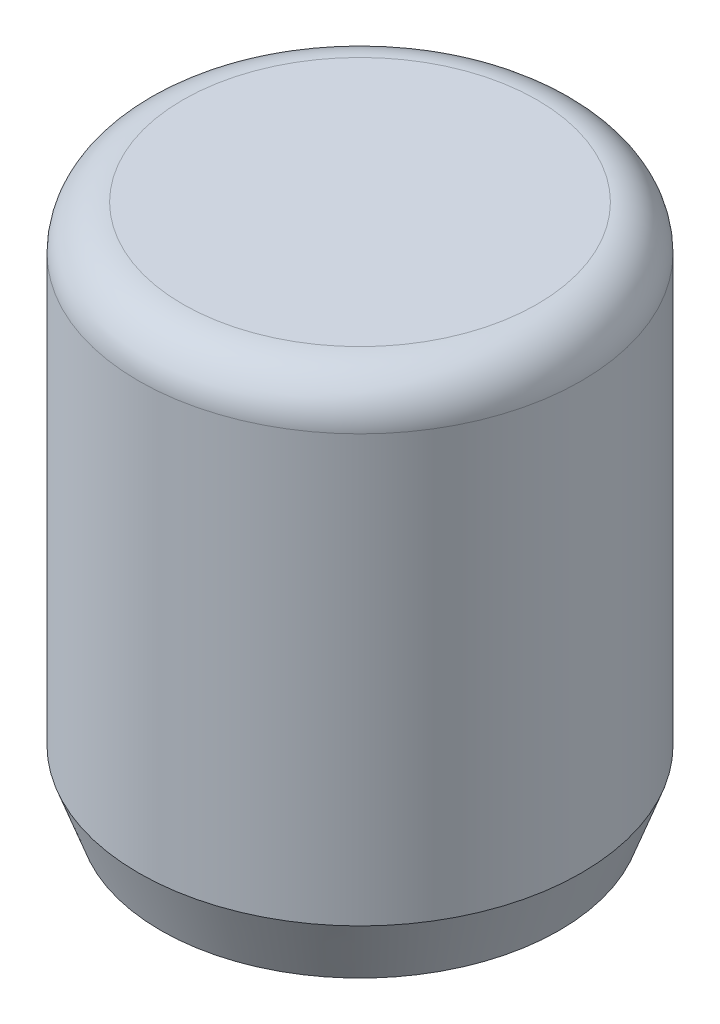
from build123d import *

# Parameters (mm, degrees)
SKETCH1_R           = 5
BOSS_EXTRUDE1_DEPTH = 12
SKETCH2_R           = 3.3
CUT_EXTRUDE1_DEPTH  = 6
FILLET1_R           = 1
CHAMFER1_SIZE       = 0.5
CHAMFER1_SIZE2      = 1.37373871


with BuildPart() as part:
    # Sketch1 → Boss-Extrude1 (new body)
    with BuildSketch(Plane(origin=(0, 0, 0), x_dir=(1, 0, 0), z_dir=(0, 1, 0))):
        Circle(SKETCH1_R)
    extrude(amount=BOSS_EXTRUDE1_DEPTH)

    # Sketch2 → Cut-Extrude1 (cut)
    with BuildSketch(Plane.XZ):
        Circle(SKETCH2_R)
    extrude(amount=-CUT_EXTRUDE1_DEPTH, mode=Mode.SUBTRACT)

    # Fillet1
    fillet1_edges = [part.edges().sort_by_distance(p)[0] for p in [
        (-5, 12, 0),
    ]]
    fillet(fillet1_edges, radius=FILLET1_R)

    # Chamfer1
    chamfer1_edges = [part.edges().sort_by_distance(p)[0] for p in [
        (-5, 0, 0),
    ]]
    chamfer1_side = [part.faces().sort_by_distance(p)[0] for p in [
        (-4.858578644, 0, 0),
    ]]
    chamfer(chamfer1_edges, length=CHAMFER1_SIZE, length2=CHAMFER1_SIZE2, reference=chamfer1_side[0])


solid = part.part
